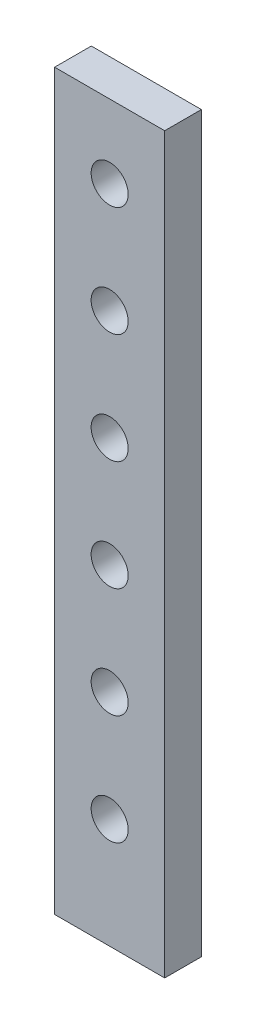
from build123d import *

# Parameters (mm, degrees)
SKETCH_1_W          = 30
SKETCH_1_H          = 200
EXTRUDE_1_DEPTH     = 10
SKETCH_2_R          = 5.05
CUT_EXTRUDE_1_DEPTH = 203.484567313


with BuildPart() as part:
    # Эскиз1 → Бобышка-Вытянуть1 (new body)
    with BuildSketch(Plane.XY):
        with Locations((15, 100)):
            Rectangle(SKETCH_1_W, SKETCH_1_H)
    extrude(amount=EXTRUDE_1_DEPTH)

    # Эскиз2 → Вырез-Вытянуть1 (cut, through all)
    with BuildSketch(Plane.XY.offset(10)):
        with Locations((15, 30)):
            Circle(SKETCH_2_R)
        with Locations((15, 60)):
            Circle(SKETCH_2_R)
        with Locations((15, 90)):
            Circle(SKETCH_2_R)
        with Locations((15, 120)):
            Circle(SKETCH_2_R)
        with Locations((15, 150)):
            Circle(SKETCH_2_R)
        with Locations((15, 180)):
            Circle(SKETCH_2_R)
    extrude(amount=-CUT_EXTRUDE_1_DEPTH, mode=Mode.SUBTRACT)


solid = part.part
